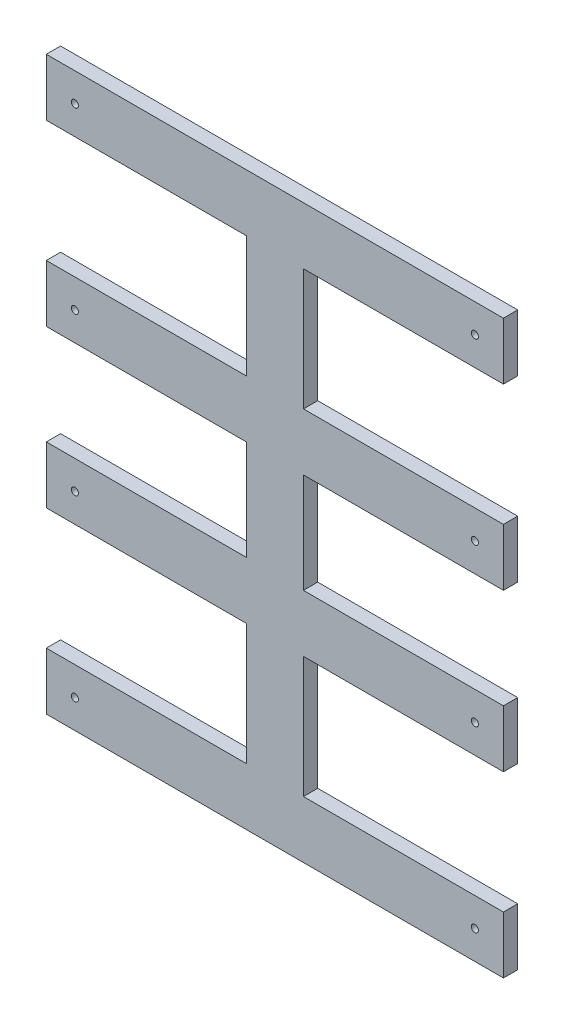
from build123d import *

# Parameters (mm, degrees)
SKETCH_1_R      = 1.5875
EXTRUDE_1_DEPTH = 6.35


with BuildPart() as part:
    # 스케치1 → 보스-돌출1 (new body)
    with BuildSketch(Plane.XY):
        Polygon((-12.7, 101.6), (-101.6, 101.6), (-101.6, 127), (101.6, 127), (101.6, 101.6), (12.7, 101.6), (12.7, 47.625), (101.6, 47.625), (101.6, 22.225), (12.7, 22.225), (12.7, -22.225), (101.6, -22.225), (101.6, -47.625), (12.7, -47.625), (12.7, -101.6), (101.6, -101.6), (101.6, -127), (-101.6, -127), (-101.6, -101.6), (-12.7, -101.6), (-12.7, -47.625), (-101.6, -47.625), (-101.6, -22.225), (-12.7, -22.225), (-12.7, 22.225), (-101.6, 22.225), (-101.6, 47.625), (-12.7, 47.625), align=None)
        with Locations((-88.9, 114.3)):
            Circle(SKETCH_1_R, mode=Mode.SUBTRACT)
        with Locations((88.9, 114.3)):
            Circle(SKETCH_1_R, mode=Mode.SUBTRACT)
        with Locations((88.9, 34.925)):
            Circle(SKETCH_1_R, mode=Mode.SUBTRACT)
        with Locations((-88.9, 34.925)):
            Circle(SKETCH_1_R, mode=Mode.SUBTRACT)
        with Locations((-88.9, -34.925)):
            Circle(SKETCH_1_R, mode=Mode.SUBTRACT)
        with Locations((88.9, -34.925)):
            Circle(SKETCH_1_R, mode=Mode.SUBTRACT)
        with Locations((88.9, -114.3)):
            Circle(SKETCH_1_R, mode=Mode.SUBTRACT)
        with Locations((-88.9, -114.3)):
            Circle(SKETCH_1_R, mode=Mode.SUBTRACT)
    extrude(amount=EXTRUDE_1_DEPTH)


solid = part.part
